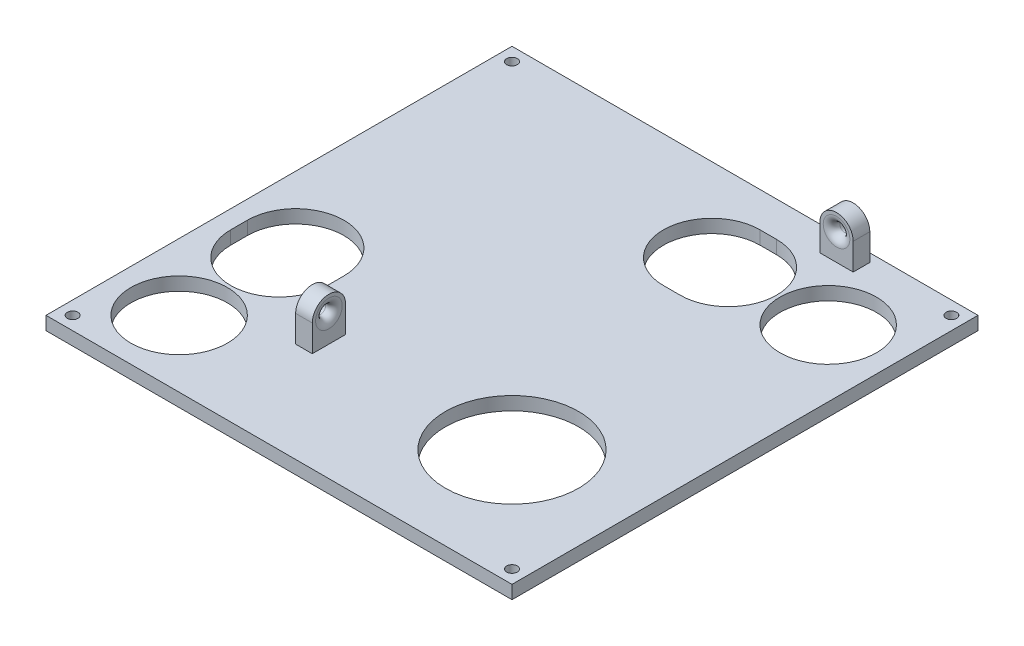
from build123d import *

# Parameters (mm, degrees)
SKETCH1_W           = 140
SKETCH1_H           = 140
BOSS_EXTRUDE1_DEPTH = 4
SKETCH2_R           = 14.5
CUT_EXTRUDE1_DEPTH  = 4
SKETCH3_R           = 20
CUT_EXTRUDE2_DEPTH  = 10
SKETCH5_R           = 1.6
CUT_EXTRUDE5_DEPTH  = 10
CUT_EXTRUDE6_DEPTH  = 10
SKETCH8_W           = 5
SKETCH8_H           = 10
SKETCH8_W_2         = 10
SKETCH8_H_2         = 5
BOSS_EXTRUDE2_DEPTH = 14
SKETCH9_R           = 1.5
CUT_EXTRUDE7_DEPTH  = 151.931275752
SKETCH10_R          = 1.5
CUT_EXTRUDE8_DEPTH  = 5
FILLET1_R           = 2.5


with BuildPart() as part:
    # Sketch1 → Boss-Extrude1 (new body)
    with BuildSketch(Plane(origin=(0, 0, 0), x_dir=(1, 0, 0), z_dir=(0, 1, 0))):
        Rectangle(SKETCH1_W, SKETCH1_H)
    extrude(amount=BOSS_EXTRUDE1_DEPTH)

    # Sketch2 → Cut-Extrude1 (cut)
    with BuildSketch(Plane(origin=(0, 4, 0), x_dir=(1, 0, 0), z_dir=(0, 1, 0))):
        with Locations(Location((50, 45, 0), (0, 0, 270))):
            Circle(SKETCH2_R)
        with Locations(Location((20, 45, 0), (0, 0, 270))):
            Circle(SKETCH2_R)
        with Locations(Location((-50, -20, 0), (0, 0, 270))):
            Circle(SKETCH2_R)
        with Locations(Location((-50, -50, 0), (0, 0, 270))):
            Circle(SKETCH2_R)
    extrude(amount=-CUT_EXTRUDE1_DEPTH, mode=Mode.SUBTRACT)

    # Sketch3 → Cut-Extrude2 (cut)
    with BuildSketch(Plane(origin=(0, 4, 0), x_dir=(1, 0, 0), z_dir=(0, 1, 0))):
        with Locations(Location((35, -35, 0), (0, 0, 270))):
            Circle(SKETCH3_R)
    extrude(amount=-CUT_EXTRUDE2_DEPTH, mode=Mode.SUBTRACT)

    # Sketch5 → Cut-Extrude5 (cut)
    with BuildSketch(Plane(origin=(0, 4, 0), x_dir=(1, 0, 0), z_dir=(0, 1, 0))):
        with Locations(Location((-66, 66, 0), (0, 0, 270))):
            Circle(SKETCH5_R)
        with Locations(Location((66, 66, 0), (0, 0, 270))):
            Circle(SKETCH5_R)
        with Locations(Location((66, -66, 0), (0, 0, 270))):
            Circle(SKETCH5_R)
        with Locations(Location((-66, -66, 0), (0, 0, 270))):
            Circle(SKETCH5_R)
    extrude(amount=-CUT_EXTRUDE5_DEPTH, mode=Mode.SUBTRACT)

    # Sketch7 → Cut-Extrude6 (cut)
    with BuildSketch(Plane(origin=(0, 4, 0), x_dir=(1, 0, 0), z_dir=(0, 1, 0))):
        with BuildLine():
            Line((-64.5, -20), (-64.5, -15))
            ThreePointArc((-64.5, -15), (-50, -0.5), (-35.5, -15))
            Line((-35.5, -15), (-35.5, -20))
            ThreePointArc((-35.5, -20), (-50, -34.5), (-64.5, -20))
        make_face()
        with BuildLine():
            Line((20, 30.5), (15, 30.5))
            ThreePointArc((15, 30.5), (0.5, 45), (15, 59.5))
            Line((15, 59.5), (20, 59.5))
            ThreePointArc((20, 59.5), (34.5, 45), (20, 30.5))
        make_face()
    extrude(amount=-CUT_EXTRUDE6_DEPTH, mode=Mode.SUBTRACT)

    # Sketch8 → Boss-Extrude2 (add)
    with BuildSketch(Plane(origin=(0, 4, 0), x_dir=(1, 0, 0), z_dir=(0, 1, 0))):
        with Locations((-22.5, -35)):
            Rectangle(SKETCH8_W, SKETCH8_H)
        with Locations((35, 65)):
            Rectangle(SKETCH8_W_2, SKETCH8_H_2)
    extrude(amount=BOSS_EXTRUDE2_DEPTH)

    # Sketch9 → Cut-Extrude7 (cut, through all)
    with BuildSketch(Plane.XY.offset(-62.5)):
        with Locations((35, 12)):
            Circle(SKETCH9_R)
        with BuildLine():
            Line((30, 12), (30, 22.099022081))
            Line((30, 22.099022081), (40, 22.099022081))
            Line((40, 22.099022081), (40, 12))
            ThreePointArc((40, 12), (35, 17), (30, 12))
        make_face()
    extrude(amount=-CUT_EXTRUDE7_DEPTH, mode=Mode.SUBTRACT)

    # Sketch10 → Cut-Extrude8 (cut)
    with BuildSketch(Plane(origin=(-20, 0, 0), x_dir=(0, 0, -1), z_dir=(1, 0, 0))):
        with Locations((-35, 12)):
            Circle(SKETCH10_R)
        with BuildLine():
            Line((-40, 12), (-40, 23.531098802))
            Line((-40, 23.531098802), (-30, 23.531098802))
            Line((-30, 23.531098802), (-30, 12))
            ThreePointArc((-30, 12), (-35, 17), (-40, 12))
        make_face()
    extrude(amount=-CUT_EXTRUDE8_DEPTH, mode=Mode.SUBTRACT)

    # Fillet1
    fillet1_edges = [part.edges().sort_by_distance(p)[0] for p in [
        (33.5, 12, -67.5),
        (33.5, 12, -62.5),
        (-25, 12, 36.5),
        (-20, 12, 36.5),
    ]]
    fillet(fillet1_edges, radius=FILLET1_R - 0.0001)  # a hair under: the kernel refuses the full size


solid = part.part
